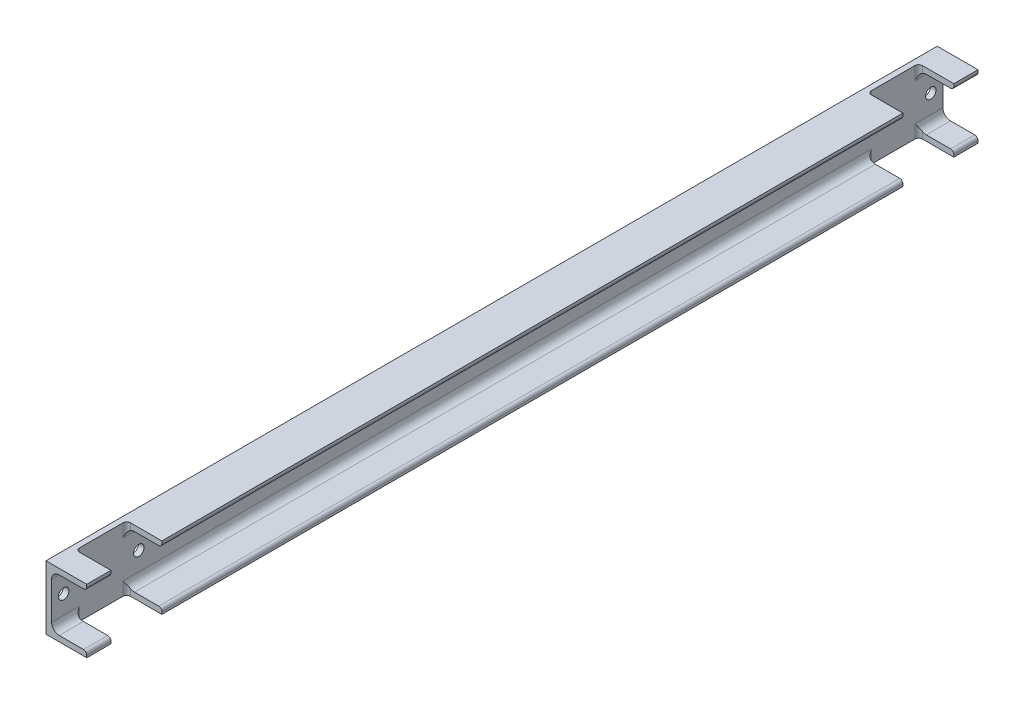
from build123d import *

# Parameters (mm, degrees)
EXTRUDE_1_DEPTH     = 350
OTHER_START         = -25
OTHER_1_DEPTH       = 50
SKETCH_4_R          = 4.1
CUT_EXTRUDE_1_DEPTH = 352.975510618


# Read off the part's stored shape, not the designer's step: Полость1
with BuildPart() as part:
    # Эскиз1 → Бобышка-Вытянуть1 (new body)
    with BuildSketch(Plane.XY):
        with BuildLine():
            Line((-4.4, -25), (-4.4, 25))
            Line((-4.4, 25), (27.6, 25))
            Line((27.6, 25), (27.6, 23.1))
            ThreePointArc((27.6, 23.1), (26.867766953, 21.332233047), (25.1, 20.6))
            Line((25.1, 20.6), (6, 20.6))
            ThreePointArc((6, 20.6), (1.757359313, 18.842640687), (0, 14.6))
            Line((0, 14.6), (0, -14.6))
            ThreePointArc((0, -14.6), (1.757359313, -18.842640687), (6, -20.6))
            Line((6, -20.6), (25.1, -20.6))
            ThreePointArc((25.1, -20.6), (26.867766953, -21.332233047), (27.6, -23.1))
            Line((27.6, -23.1), (27.6, -25))
            Line((27.6, -25), (-4.4, -25))
        make_face()
    extrude(amount=EXTRUDE_1_DEPTH)

    # Полость1 outline → Полость1 (cut)
    with BuildSketch(Plane(origin=(0, 0, 0), x_dir=(1, 0, 0), z_dir=(0, 1, 0)).offset(OTHER_START)):
        with BuildLine():
            ThreePointArc((3, -291), (0.878679656, -291.878679656), (0, -294))
            Line((0, -294), (0, -328))
            ThreePointArc((0, -328), (0.878679656, -330.121320344), (3, -331))
            Line((3, -331), (27.6, -331))
            Line((27.6, -331), (27.6, -291))
            Line((27.6, -291), (3, -291))
        make_face()
    extrude(amount=OTHER_1_DEPTH, mode=Mode.SUBTRACT)

    # Эскиз4 → Вырез-Вытянуть1 (cut, through all)
    with BuildSketch(Plane(origin=(0, 0, 0), x_dir=(0, 0, -1), z_dir=(1, 0, 0))):
        with Locations((-340.5, 0)):
            Circle(SKETCH_4_R)
        with Locations((-281.5, 0)):
            Circle(SKETCH_4_R)
    extrude(amount=-CUT_EXTRUDE_1_DEPTH, mode=Mode.SUBTRACT)

    # Зеркальное отражение1: part across plane


with BuildPart() as part_1:
    add(part.part)
    add(part.part.mirror(Plane(origin=(25.1, 23.1, 0), x_dir=(1, 0, 0), z_dir=(0, 0, -1))))


solid = part_1.part
